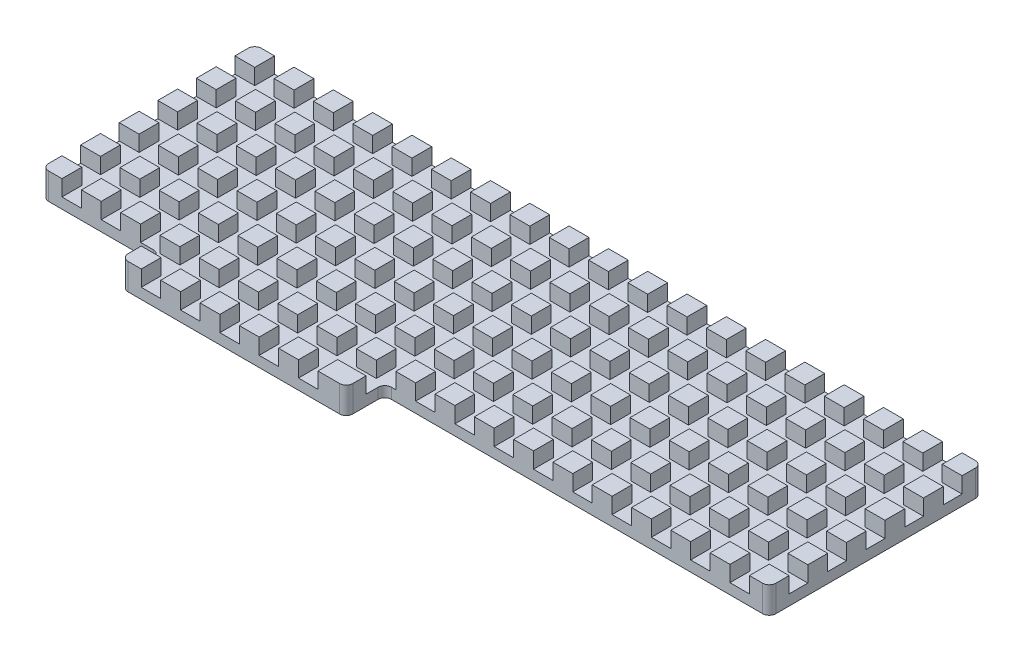
from build123d import *

# Parameters (mm, degrees)
BOSS_EXTRUDE1_DEPTH = 0.8
SKETCH2_W           = 1.5
SKETCH2_H           = 1.5
SKETCH2_W_2         = 2.138888889
BOSS_EXTRUDE2_DEPTH = 2
FILLET1_START       = -1
FILLET1_DEPTH       = 4
FILLET1_2_DEPTH     = 0.8


with BuildPart() as part:
    # Sketch1 → Boss-Extrude1 (new body)
    with BuildSketch(Plane(origin=(0, 0, 0), x_dir=(1, 0, 0), z_dir=(0, 1, 0))):
        Polygon((-27.5, -6.583333333), (-27.5, 9.5), (27.5, 9.5), (27.5, -6.583333333), (-1.583333333, -6.583333333), (-1.583333333, -9.5), (-18.583333333, -9.5), (-18.583333333, -6.583333333), align=None)
    extrude(amount=BOSS_EXTRUDE1_DEPTH)

    # Sketch2 → Boss-Extrude2 (add)
    with BuildSketch(Plane(origin=(0, 0, 0), x_dir=(1, 0, 0), z_dir=(0, 1, 0))):
        with Locations((-23.777777778, 8.75)):
            Rectangle(SKETCH2_W, SKETCH2_H)
        with Locations((-26.75, 8.75)):
            Rectangle(SKETCH2_W, SKETCH2_H)
        with Locations((-20.805555556, 8.75)):
            Rectangle(SKETCH2_W, SKETCH2_H)
        with Locations((-17.833333333, 8.75)):
            Rectangle(SKETCH2_W, SKETCH2_H)
        with Locations((-14.861111111, 8.75)):
            Rectangle(SKETCH2_W, SKETCH2_H)
        with Locations((-11.888888889, 8.75)):
            Rectangle(SKETCH2_W, SKETCH2_H)
        with Locations((-8.916666667, 8.75)):
            Rectangle(SKETCH2_W, SKETCH2_H)
        with Locations((-5.944444444, 8.75)):
            Rectangle(SKETCH2_W, SKETCH2_H)
        with Locations((-2.972222222, 8.75)):
            Rectangle(SKETCH2_W, SKETCH2_H)
        with Locations((0, 8.75)):
            Rectangle(SKETCH2_W, SKETCH2_H)
        with Locations((2.972222222, 8.75)):
            Rectangle(SKETCH2_W, SKETCH2_H)
        with Locations((5.944444444, 8.75)):
            Rectangle(SKETCH2_W, SKETCH2_H)
        with Locations((8.916666667, 8.75)):
            Rectangle(SKETCH2_W, SKETCH2_H)
        with Locations((11.888888889, 8.75)):
            Rectangle(SKETCH2_W, SKETCH2_H)
        with Locations((14.861111111, 8.75)):
            Rectangle(SKETCH2_W, SKETCH2_H)
        with Locations((17.833333333, 8.75)):
            Rectangle(SKETCH2_W, SKETCH2_H)
        with Locations((20.805555556, 8.75)):
            Rectangle(SKETCH2_W, SKETCH2_H)
        with Locations((23.777777778, 8.75)):
            Rectangle(SKETCH2_W, SKETCH2_H)
        with Locations((26.75, 8.75)):
            Rectangle(SKETCH2_W, SKETCH2_H)
        with Locations((-23.777777778, 5.833333333)):
            Rectangle(SKETCH2_W, SKETCH2_H)
        with Locations((-20.805555556, 5.833333333)):
            Rectangle(SKETCH2_W, SKETCH2_H)
        with Locations((-17.833333333, 5.833333333)):
            Rectangle(SKETCH2_W, SKETCH2_H)
        with Locations((-14.861111111, 5.833333333)):
            Rectangle(SKETCH2_W, SKETCH2_H)
        with Locations((-11.888888889, 5.833333333)):
            Rectangle(SKETCH2_W, SKETCH2_H)
        with Locations((-8.916666667, 5.833333333)):
            Rectangle(SKETCH2_W, SKETCH2_H)
        with Locations((-5.944444444, 5.833333333)):
            Rectangle(SKETCH2_W, SKETCH2_H)
        with Locations((-2.972222222, 5.833333333)):
            Rectangle(SKETCH2_W, SKETCH2_H)
        with Locations((0, 5.833333333)):
            Rectangle(SKETCH2_W, SKETCH2_H)
        with Locations((2.972222222, 5.833333333)):
            Rectangle(SKETCH2_W, SKETCH2_H)
        with Locations((5.944444444, 5.833333333)):
            Rectangle(SKETCH2_W, SKETCH2_H)
        with Locations((8.916666667, 5.833333333)):
            Rectangle(SKETCH2_W, SKETCH2_H)
        with Locations((11.888888889, 5.833333333)):
            Rectangle(SKETCH2_W, SKETCH2_H)
        with Locations((14.861111111, 5.833333333)):
            Rectangle(SKETCH2_W, SKETCH2_H)
        with Locations((17.833333333, 5.833333333)):
            Rectangle(SKETCH2_W, SKETCH2_H)
        with Locations((20.805555556, 5.833333333)):
            Rectangle(SKETCH2_W, SKETCH2_H)
        with Locations((23.777777778, 5.833333333)):
            Rectangle(SKETCH2_W, SKETCH2_H)
        with Locations((26.75, 5.833333333)):
            Rectangle(SKETCH2_W, SKETCH2_H)
        with Locations((-23.777777778, 2.916666667)):
            Rectangle(SKETCH2_W, SKETCH2_H)
        with Locations((-20.805555556, 2.916666667)):
            Rectangle(SKETCH2_W, SKETCH2_H)
        with Locations((-17.833333333, 2.916666667)):
            Rectangle(SKETCH2_W, SKETCH2_H)
        with Locations((-14.861111111, 2.916666667)):
            Rectangle(SKETCH2_W, SKETCH2_H)
        with Locations((-11.888888889, 2.916666667)):
            Rectangle(SKETCH2_W, SKETCH2_H)
        with Locations((-8.916666667, 2.916666667)):
            Rectangle(SKETCH2_W, SKETCH2_H)
        with Locations((-5.944444444, 2.916666667)):
            Rectangle(SKETCH2_W, SKETCH2_H)
        with Locations((-2.972222222, 2.916666667)):
            Rectangle(SKETCH2_W, SKETCH2_H)
        with Locations((0, 2.916666667)):
            Rectangle(SKETCH2_W, SKETCH2_H)
        with Locations((2.972222222, 2.916666667)):
            Rectangle(SKETCH2_W, SKETCH2_H)
        with Locations((5.944444444, 2.916666667)):
            Rectangle(SKETCH2_W, SKETCH2_H)
        with Locations((8.916666667, 2.916666667)):
            Rectangle(SKETCH2_W, SKETCH2_H)
        with Locations((11.888888889, 2.916666667)):
            Rectangle(SKETCH2_W, SKETCH2_H)
        with Locations((14.861111111, 2.916666667)):
            Rectangle(SKETCH2_W, SKETCH2_H)
        with Locations((17.833333333, 2.916666667)):
            Rectangle(SKETCH2_W, SKETCH2_H)
        with Locations((20.805555556, 2.916666667)):
            Rectangle(SKETCH2_W, SKETCH2_H)
        with Locations((23.777777778, 2.916666667)):
            Rectangle(SKETCH2_W, SKETCH2_H)
        with Locations((26.75, 2.916666667)):
            Rectangle(SKETCH2_W, SKETCH2_H)
        with Locations((-23.777777778, 0)):
            Rectangle(SKETCH2_W, SKETCH2_H)
        with Locations((-20.805555556, 0)):
            Rectangle(SKETCH2_W, SKETCH2_H)
        with Locations((-17.833333333, 0)):
            Rectangle(SKETCH2_W, SKETCH2_H)
        with Locations((-14.861111111, 0)):
            Rectangle(SKETCH2_W, SKETCH2_H)
        with Locations((-11.888888889, 0)):
            Rectangle(SKETCH2_W, SKETCH2_H)
        with Locations((-8.916666667, 0)):
            Rectangle(SKETCH2_W, SKETCH2_H)
        with Locations((-5.944444444, 0)):
            Rectangle(SKETCH2_W, SKETCH2_H)
        with Locations((-2.972222222, 0)):
            Rectangle(SKETCH2_W, SKETCH2_H)
        Rectangle(SKETCH2_W, SKETCH2_H)
        with Locations((2.972222222, 0)):
            Rectangle(SKETCH2_W, SKETCH2_H)
        with Locations((5.944444444, 0)):
            Rectangle(SKETCH2_W, SKETCH2_H)
        with Locations((8.916666667, 0)):
            Rectangle(SKETCH2_W, SKETCH2_H)
        with Locations((11.888888889, 0)):
            Rectangle(SKETCH2_W, SKETCH2_H)
        with Locations((14.861111111, 0)):
            Rectangle(SKETCH2_W, SKETCH2_H)
        with Locations((17.833333333, 0)):
            Rectangle(SKETCH2_W, SKETCH2_H)
        with Locations((20.805555556, 0)):
            Rectangle(SKETCH2_W, SKETCH2_H)
        with Locations((23.777777778, 0)):
            Rectangle(SKETCH2_W, SKETCH2_H)
        with Locations((26.75, 0)):
            Rectangle(SKETCH2_W, SKETCH2_H)
        with Locations((-23.777777778, -2.916666667)):
            Rectangle(SKETCH2_W, SKETCH2_H)
        with Locations((-20.805555556, -2.916666667)):
            Rectangle(SKETCH2_W, SKETCH2_H)
        with Locations((-17.833333333, -2.916666667)):
            Rectangle(SKETCH2_W, SKETCH2_H)
        with Locations((-14.861111111, -2.916666667)):
            Rectangle(SKETCH2_W, SKETCH2_H)
        with Locations((-11.888888889, -2.916666667)):
            Rectangle(SKETCH2_W, SKETCH2_H)
        with Locations((-8.916666667, -2.916666667)):
            Rectangle(SKETCH2_W, SKETCH2_H)
        with Locations((-5.944444444, -2.916666667)):
            Rectangle(SKETCH2_W, SKETCH2_H)
        with Locations((-2.972222222, -2.916666667)):
            Rectangle(SKETCH2_W, SKETCH2_H)
        with Locations((0, -2.916666667)):
            Rectangle(SKETCH2_W, SKETCH2_H)
        with Locations((2.972222222, -2.916666667)):
            Rectangle(SKETCH2_W, SKETCH2_H)
        with Locations((5.944444444, -2.916666667)):
            Rectangle(SKETCH2_W, SKETCH2_H)
        with Locations((8.916666667, -2.916666667)):
            Rectangle(SKETCH2_W, SKETCH2_H)
        with Locations((11.888888889, -2.916666667)):
            Rectangle(SKETCH2_W, SKETCH2_H)
        with Locations((14.861111111, -2.916666667)):
            Rectangle(SKETCH2_W, SKETCH2_H)
        with Locations((17.833333333, -2.916666667)):
            Rectangle(SKETCH2_W, SKETCH2_H)
        with Locations((20.805555556, -2.916666667)):
            Rectangle(SKETCH2_W, SKETCH2_H)
        with Locations((23.777777778, -2.916666667)):
            Rectangle(SKETCH2_W, SKETCH2_H)
        with Locations((26.75, -2.916666667)):
            Rectangle(SKETCH2_W, SKETCH2_H)
        with Locations((-23.777777778, -5.833333333)):
            Rectangle(SKETCH2_W, SKETCH2_H)
        with Locations((-20.805555556, -5.833333333)):
            Rectangle(SKETCH2_W, SKETCH2_H)
        with Locations((-17.833333333, -5.833333333)):
            Rectangle(SKETCH2_W, SKETCH2_H)
        with Locations((-14.861111111, -5.833333333)):
            Rectangle(SKETCH2_W, SKETCH2_H)
        with Locations((-11.888888889, -5.833333333)):
            Rectangle(SKETCH2_W, SKETCH2_H)
        with Locations((-8.916666667, -5.833333333)):
            Rectangle(SKETCH2_W, SKETCH2_H)
        with Locations((-5.944444444, -5.833333333)):
            Rectangle(SKETCH2_W, SKETCH2_H)
        with Locations((-2.972222222, -5.833333333)):
            Rectangle(SKETCH2_W, SKETCH2_H)
        with Locations((0, -5.833333333)):
            Rectangle(SKETCH2_W, SKETCH2_H)
        with Locations((2.972222222, -5.833333333)):
            Rectangle(SKETCH2_W, SKETCH2_H)
        with Locations((5.944444444, -5.833333333)):
            Rectangle(SKETCH2_W, SKETCH2_H)
        with Locations((8.916666667, -5.833333333)):
            Rectangle(SKETCH2_W, SKETCH2_H)
        with Locations((11.888888889, -5.833333333)):
            Rectangle(SKETCH2_W, SKETCH2_H)
        with Locations((14.861111111, -5.833333333)):
            Rectangle(SKETCH2_W, SKETCH2_H)
        with Locations((17.833333333, -5.833333333)):
            Rectangle(SKETCH2_W, SKETCH2_H)
        with Locations((20.805555556, -5.833333333)):
            Rectangle(SKETCH2_W, SKETCH2_H)
        with Locations((23.777777778, -5.833333333)):
            Rectangle(SKETCH2_W, SKETCH2_H)
        with Locations((26.75, -5.833333333)):
            Rectangle(SKETCH2_W, SKETCH2_H)
        with Locations((-17.833333333, -8.75)):
            Rectangle(SKETCH2_W, SKETCH2_H)
        with Locations((-14.861111111, -8.75)):
            Rectangle(SKETCH2_W, SKETCH2_H)
        with Locations((-11.888888889, -8.75)):
            Rectangle(SKETCH2_W, SKETCH2_H)
        with Locations((-8.916666667, -8.75)):
            Rectangle(SKETCH2_W, SKETCH2_H)
        with Locations((-5.944444444, -8.75)):
            Rectangle(SKETCH2_W, SKETCH2_H)
        with Locations((-26.75, 5.833333333)):
            Rectangle(SKETCH2_W, SKETCH2_H)
        with Locations((-26.75, 2.916666667)):
            Rectangle(SKETCH2_W, SKETCH2_H)
        with Locations((-26.75, 0)):
            Rectangle(SKETCH2_W, SKETCH2_H)
        with Locations((-26.75, -2.916666667)):
            Rectangle(SKETCH2_W, SKETCH2_H)
        with Locations((-26.75, -5.833333333)):
            Rectangle(SKETCH2_W, SKETCH2_H)
        with Locations((-2.652777777, -8.75)):
            Rectangle(SKETCH2_W_2, SKETCH2_H)
    extrude(amount=BOSS_EXTRUDE2_DEPTH)

    # Fillet1: read off the stored shape, not the designer's step
    # Fillet1 outline → Fillet1 (cut)
    with BuildSketch(Plane(origin=(0, 0, 0), x_dir=(1, 0, 0), z_dir=(0, 1, 0)).offset(FILLET1_START)):
        with BuildLine():
            Line((27.5, 9.5), (27, 9.5))
            ThreePointArc((27, 9.5), (27.353553391, 9.353553391), (27.5, 9))
            Line((27.5, 9), (27.5, 9.5))
        make_face()
        with BuildLine():
            ThreePointArc((-27.5, 9), (-27.353553391, 9.353553391), (-27, 9.5))
            Line((-27, 9.5), (-27.5, 9.5))
            Line((-27.5, 9.5), (-27.5, 9))
        make_face()
        with BuildLine():
            Line((27.5, -6.583333333), (27.5, -6.083333333))
            ThreePointArc((27.5, -6.083333333), (27.353553391, -6.436886724), (27, -6.583333333))
            Line((27, -6.583333333), (27.5, -6.583333333))
        make_face()
        with BuildLine():
            ThreePointArc((-27, -6.583333333), (-27.353553391, -6.436886724), (-27.5, -6.083333333))
            Line((-27.5, -6.083333333), (-27.5, -6.583333333))
            Line((-27.5, -6.583333333), (-27, -6.583333333))
        make_face()
        with BuildLine():
            Line((-1.583333333, -9.5), (-1.583333333, -9))
            ThreePointArc((-1.583333333, -9), (-1.729779943, -9.353553391), (-2.083333333, -9.5))
            Line((-2.083333333, -9.5), (-1.583333333, -9.5))
        make_face()
        with BuildLine():
            ThreePointArc((-18.083333333, -9.5), (-18.436886724, -9.353553391), (-18.583333333, -9))
            Line((-18.583333333, -9), (-18.583333333, -9.5))
            Line((-18.583333333, -9.5), (-18.083333333, -9.5))
        make_face()
    extrude(amount=FILLET1_DEPTH, mode=Mode.SUBTRACT)

    # Fillet1 2 outline → Fillet1 2 (add)
    with BuildSketch(Plane(origin=(0, 0, 0), x_dir=(1, 0, 0), z_dir=(0, 1, 0))):
        with BuildLine():
            ThreePointArc((-1.583333333, -7.083333333), (-1.436886724, -6.729779942), (-1.083333333, -6.583333333))
            Line((-1.083333333, -6.583333333), (-1.583333333, -6.583333333))
            Line((-1.583333333, -6.583333333), (-1.583333333, -7.083333333))
        make_face()
        with BuildLine():
            Line((-18.583333333, -6.583333333), (-19.083333333, -6.583333333))
            ThreePointArc((-19.083333333, -6.583333333), (-18.729779943, -6.729779943), (-18.583333333, -7.083333333))
            Line((-18.583333333, -7.083333333), (-18.583333333, -6.583333333))
        make_face()
    extrude(amount=FILLET1_2_DEPTH)


solid = part.part
